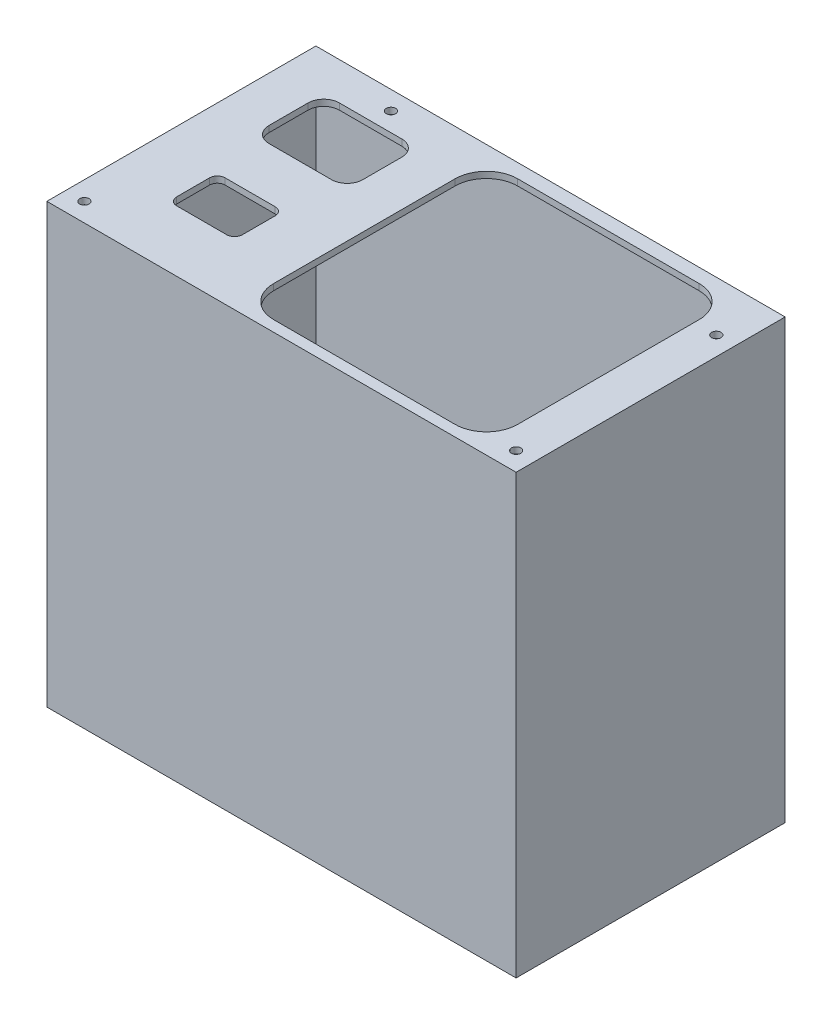
from build123d import *

# Parameters (mm, degrees)
SKETCH1_W            = 150
SKETCH1_H            = 86
BOSS_EXTRUDE1_DEPTH  = 140
SKETCH2_R            = 1.5
SKETCH2_W            = 78
SKETCH2_H            = 78
SKETCH2_W_2          = 30
SKETCH2_H_2          = 22.5
SKETCH2_W_3          = 21
SKETCH2_H_3          = 15.5
CUT_EXTRUDE1_DEPTH   = 2
SHELL4_START         = 1
SHELL4_OUTLINE_W     = 148
SHELL4_OUTLINE_H     = 84
SHELL4_DEPTH         = 137
SHELL4_START_2       = 138
SHELL4_2_OUTLINE_W   = 148
SHELL4_2_OUTLINE_H   = 84
SHELL4_2_OUTLINE_R   = 2.5
SHELL4_2_OUTLINE_W_2 = 23
SHELL4_2_OUTLINE_H_2 = 17.5
SHELL4_2_OUTLINE_W_3 = 80
SHELL4_2_OUTLINE_H_3 = 80
SHELL4_2_OUTLINE_W_4 = 32
SHELL4_2_OUTLINE_H_4 = 24.5
SHELL4_2_DEPTH       = 1
FILLET1_R            = 10
FILLET2_R            = 5
FILLET3_R            = 2.5


# Read off the part's stored shape, not the designer's step: Shell4
with BuildPart() as part:
    # Sketch1 → Boss-Extrude1 (new body)
    with BuildSketch(Plane(origin=(0, 0, 0), x_dir=(1, 0, 0), z_dir=(0, 1, 0))):
        Rectangle(SKETCH1_W, SKETCH1_H)
    extrude(amount=BOSS_EXTRUDE1_DEPTH)

    # Sketch2 → Cut-Extrude1 (cut)
    with BuildSketch(Plane(origin=(0, 140, 0), x_dir=(1, 0, 0), z_dir=(0, 1, 0))):
        with Locations(Location((69, -37, 0), (0, 0, 270))):
            Circle(SKETCH2_R)
        with Locations(Location((69, 27, 0), (0, 0, 270))):
            Circle(SKETCH2_R)
        with Locations(Location((-69, -37, 0), (0, 0, 270))):
            Circle(SKETCH2_R)
        with Locations(Location((-45, 37, 0), (0, 0, 270))):
            Circle(SKETCH2_R)
        with Locations((23, -0.5)):
            Rectangle(SKETCH2_W, SKETCH2_H)
        with Locations((-45.5, 19.75)):
            Rectangle(SKETCH2_W_2, SKETCH2_H_2)
        with Locations((-45, -15.75)):
            Rectangle(SKETCH2_W_3, SKETCH2_H_3)
    extrude(amount=-CUT_EXTRUDE1_DEPTH, mode=Mode.SUBTRACT)

    # Shell4 outline → Shell4 (cut)
    with BuildSketch(Plane(origin=(0, 0, 0), x_dir=(1, 0, 0), z_dir=(0, 1, 0)).offset(SHELL4_START)):
        Rectangle(SHELL4_OUTLINE_W, SHELL4_OUTLINE_H)
    extrude(amount=SHELL4_DEPTH, mode=Mode.SUBTRACT)

    # Shell4 2 outline → Shell4 2 (cut)
    with BuildSketch(Plane(origin=(0, 0, 0), x_dir=(1, 0, 0), z_dir=(0, 1, 0)).offset(SHELL4_START_2)):
        Rectangle(SHELL4_2_OUTLINE_W, SHELL4_2_OUTLINE_H)
        with Locations((-69, -37)):
            Circle(SHELL4_2_OUTLINE_R, mode=Mode.SUBTRACT)
        with Locations((-45, -15.75)):
            Rectangle(SHELL4_2_OUTLINE_W_2, SHELL4_2_OUTLINE_H_2, mode=Mode.SUBTRACT)
        with Locations((69, -37)):
            Circle(SHELL4_2_OUTLINE_R, mode=Mode.SUBTRACT)
        with Locations((23, -0.5)):
            Rectangle(SHELL4_2_OUTLINE_W_3, SHELL4_2_OUTLINE_H_3, mode=Mode.SUBTRACT)
        with Locations((-45.5, 19.75)):
            Rectangle(SHELL4_2_OUTLINE_W_4, SHELL4_2_OUTLINE_H_4, mode=Mode.SUBTRACT)
        with Locations((-45, 37)):
            Circle(SHELL4_2_OUTLINE_R, mode=Mode.SUBTRACT)
        with Locations((69, 27)):
            Circle(SHELL4_2_OUTLINE_R, mode=Mode.SUBTRACT)
    extrude(amount=SHELL4_2_DEPTH, mode=Mode.SUBTRACT)

    # Fillet1
    fillet1_edges = [part.edges().sort_by_distance(p)[0] for p in [
        (-16, 139, 39.5),
        (-16, 139, -38.5),
        (62, 139, -38.5),
        (62, 139, 39.5),
    ]]
    fillet(fillet1_edges, radius=FILLET1_R)

    # Fillet2
    fillet2_edges = [part.edges().sort_by_distance(p)[0] for p in [
        (-60.5, 139, -8.5),
        (-60.5, 139, -31),
        (-30.5, 139, -31),
        (-30.5, 139, -8.5),
    ]]
    fillet(fillet2_edges, radius=FILLET2_R)

    # Fillet3
    fillet3_edges = [part.edges().sort_by_distance(p)[0] for p in [
        (-55.5, 139, 23.5),
        (-55.5, 139, 8),
        (-34.5, 139, 8),
        (-34.5, 139, 23.5),
    ]]
    fillet(fillet3_edges, radius=FILLET3_R)


solid = part.part
